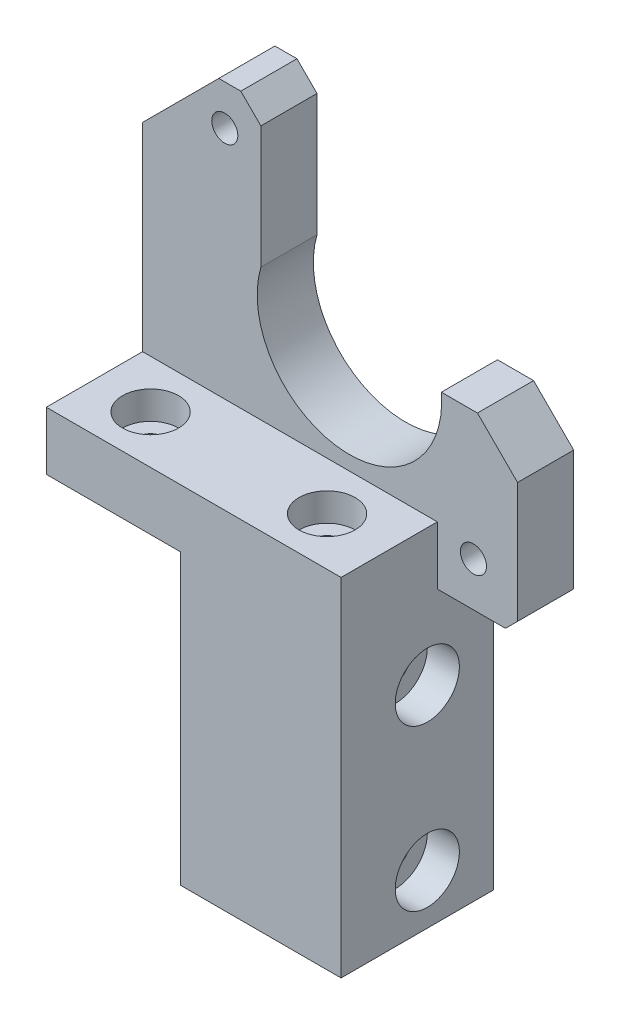
from build123d import *

# Parameters (mm, degrees)
BOSS_EXTRUDE1_DEPTH = 19
BOSS_EXTRUDE2_DEPTH = 7
SKETCH3_R           = 1.75
CUT_EXTRUDE1_DEPTH  = 88.851081382
SKETCH4_R           = 1.625
CUT_EXTRUDE2_DEPTH  = 7.25
SKETCH5_R           = 3.5
CUT_EXTRUDE3_DEPTH  = 3.5
SKETCH6_R           = 4
CUT_EXTRUDE4_DEPTH  = 4
SKETCH7_R           = 1.625
CUT_EXTRUDE5_DEPTH  = 86.248167136


with BuildPart() as part:
    # Sketch1 → Boss-Extrude1 (new body)
    with BuildSketch(Plane.XY):
        Polygon((0, 0), (20, 0), (20, 43.25), (-16.75, 43.25), (-16.75, 36), (0, 36), align=None)
    extrude(amount=BOSS_EXTRUDE1_DEPTH)

    # Sketch2 → Boss-Extrude2 (add)
    with BuildSketch(Plane(origin=(0, 0, 0), x_dir=(-1, 0, 0), z_dir=(0, 0, -1))):
        with BuildLine():
            Line((-20, 36), (16.75, 36))
            Line((16.75, 36), (16.75, 68))
            Line((16.75, 68), (7.25, 77.5))
            Line((7.25, 77.5), (4.5, 77.5))
            Line((4.5, 77.5), (2, 75))
            Line((2, 75), (2, 59.75))
            ThreePointArc((2, 59.75), (-7.896468276, 45.089682755), (-20.5, 57.5))
            Line((-20.5, 57.5), (-25, 57.5))
            Line((-25, 57.5), (-30, 52.5))
            Line((-30, 52.5), (-30, 37.5))
            Line((-30, 37.5), (-28.5, 36))
            Line((-28.5, 36), (-20, 36))
        make_face()
    extrude(amount=-BOSS_EXTRUDE2_DEPTH)

    # Sketch3 → Cut-Extrude1 (cut, through all)
    with BuildSketch(Plane(origin=(20, 0, 0), x_dir=(0, 0, -1), z_dir=(1, 0, 0))):
        with Locations((-8.25, 26.25)):
            Circle(SKETCH3_R)
        with Locations((-8.25, 6.25)):
            Circle(SKETCH3_R)
    extrude(amount=-CUT_EXTRUDE1_DEPTH, mode=Mode.SUBTRACT)

    # Sketch4 → Cut-Extrude2 (cut)
    with BuildSketch(Plane(origin=(0, 43.25, 0), x_dir=(1, 0, 0), z_dir=(0, 1, 0))):
        with Locations((-9.75, -13)):
            Circle(SKETCH4_R)
        with Locations((12.25, -13)):
            Circle(SKETCH4_R)
    extrude(amount=-CUT_EXTRUDE2_DEPTH, mode=Mode.SUBTRACT)

    # Sketch5 → Cut-Extrude3 (cut)
    with BuildSketch(Plane(origin=(0, 43.25, 0), x_dir=(1, 0, 0), z_dir=(0, 1, 0))):
        with Locations((-9.75, -13)):
            Circle(SKETCH5_R)
        with Locations((12.25, -13)):
            Circle(SKETCH5_R)
    extrude(amount=-CUT_EXTRUDE3_DEPTH, mode=Mode.SUBTRACT)

    # Sketch6 → Cut-Extrude4 (cut)
    with BuildSketch(Plane(origin=(20, 0, 0), x_dir=(0, 0, -1), z_dir=(1, 0, 0))):
        with Locations((-8.25, 26.25)):
            Circle(SKETCH6_R)
        with Locations((-8.25, 6.25)):
            Circle(SKETCH6_R)
    extrude(amount=-CUT_EXTRUDE4_DEPTH, mode=Mode.SUBTRACT)

    # Sketch7 → Cut-Extrude5 (cut, through all)
    with BuildSketch(Plane(origin=(0, 0, 0), x_dir=(-1, 0, 0), z_dir=(0, 0, -1))):
        with Locations((6.5, 72.5)):
            Circle(SKETCH7_R)
        with Locations((-24.5, 41.5)):
            Circle(SKETCH7_R)
    extrude(amount=-CUT_EXTRUDE5_DEPTH, mode=Mode.SUBTRACT)


solid = part.part
